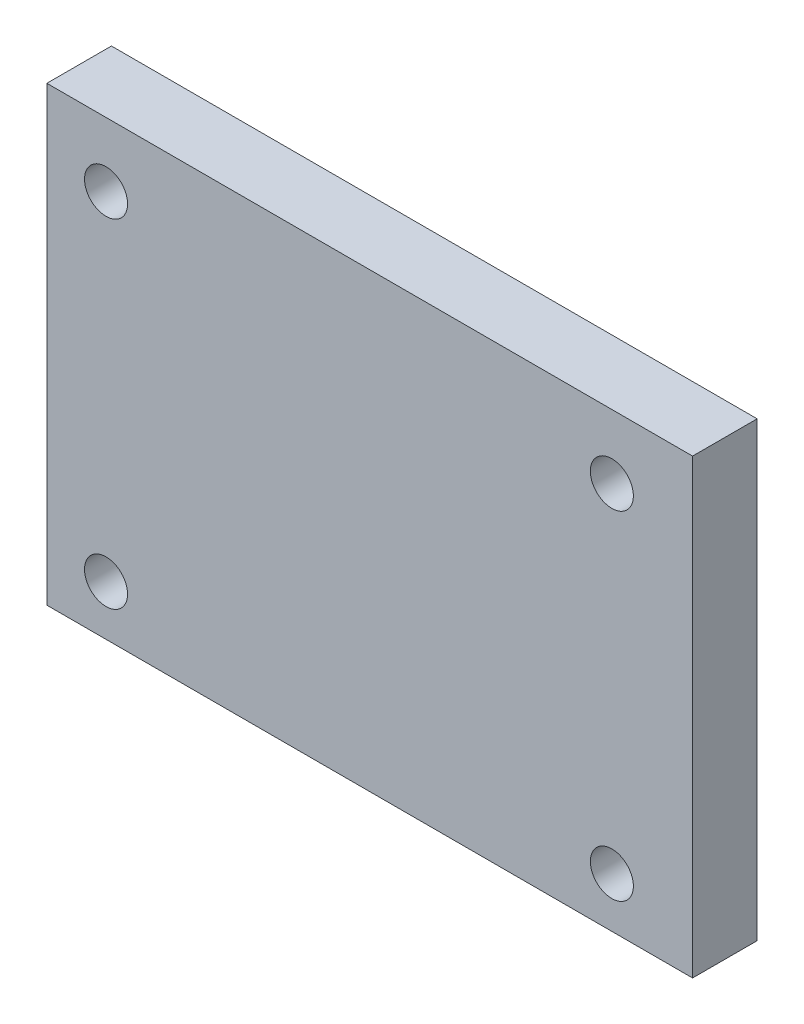
from build123d import *

# Parameters (mm, degrees)
ESQUISSE1_W             = 300
ESQUISSE1_H             = 210
BOSS_EXTRU_1_DEPTH      = 30
ESQUISSE2_R             = 10
ENL_V_MAT_EXTRU_1_DEPTH = 30


with BuildPart() as part:
    # Esquisse1 → Boss.-Extru.1 (new body)
    with BuildSketch(Plane.XY):
        with Locations((150, 105)):
            Rectangle(ESQUISSE1_W, ESQUISSE1_H)
    extrude(amount=BOSS_EXTRU_1_DEPTH)

    # Esquisse2 → Enlèv. mat.-Extru.1 (cut)
    with BuildSketch(Plane(origin=(0, 0, 0), x_dir=(-1, 0, 0), z_dir=(0, 0, -1))):
        with Locations((-27.5, 23.205885432)):
            Circle(ESQUISSE2_R)
        with Locations((-27.5, 180.205885432)):
            Circle(ESQUISSE2_R)
        with Locations((-262.500000473, 180.205885432)):
            Circle(ESQUISSE2_R)
        with Locations((-262.500000473, 23.205885432)):
            Circle(ESQUISSE2_R)
    extrude(amount=-ENL_V_MAT_EXTRU_1_DEPTH, mode=Mode.SUBTRACT)


solid = part.part
